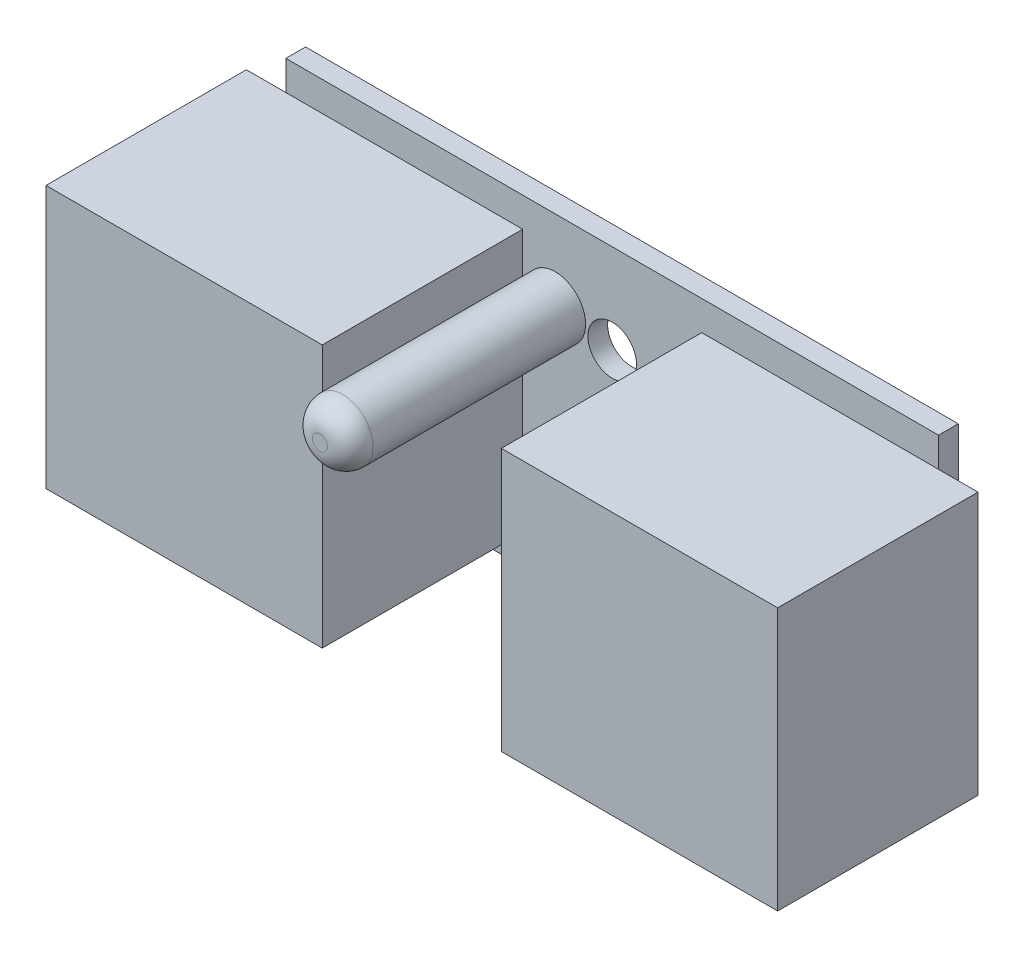
from build123d import *

# Parameters (mm, degrees)
SKETCH1_W           = 43
SKETCH1_H           = 21.2
SKETCH1_R           = 1.6
BOSS_EXTRUDE1_DEPTH = 1.3
SKETCH2_R           = 2
BOSS_EXTRUDE2_DEPTH = 15.5
FILLET1_R           = 1.5
SKETCH3_W           = 18.2
SKETCH3_H           = 17.3
BOSS_EXTRUDE3_DEPTH = 13.2


with BuildPart() as part:
    # Sketch1 → Boss-Extrude1 (new body)
    with BuildSketch(Plane.XY):
        with Locations((21.5, 10.6)):
            Rectangle(SKETCH1_W, SKETCH1_H)
        with Locations((21.5, 15.3)):
            Circle(SKETCH1_R, mode=Mode.SUBTRACT)
    extrude(amount=BOSS_EXTRUDE1_DEPTH)

    # Sketch2 → Boss-Extrude2 (add)
    with BuildSketch(Plane.XY.offset(1.3)):
        with Locations((17.75, 15.9)):
            Circle(SKETCH2_R)
    extrude(amount=BOSS_EXTRUDE2_DEPTH)

    # Fillet1
    fillet1_edges = [part.edges().sort_by_distance(p)[0] for p in [
        (15.75, 15.9, 16.8),
    ]]
    fillet(fillet1_edges, radius=FILLET1_R)

    # Sketch3 → Boss-Extrude3 (add)
    with BuildSketch(Plane.XY.offset(1.3)):
        with Locations((36.5, 10.6)):
            Rectangle(SKETCH3_W, SKETCH3_H)
        with Locations((6.5, 10.6)):
            Rectangle(SKETCH3_W, SKETCH3_H)
    extrude(amount=BOSS_EXTRUDE3_DEPTH)


solid = part.part
